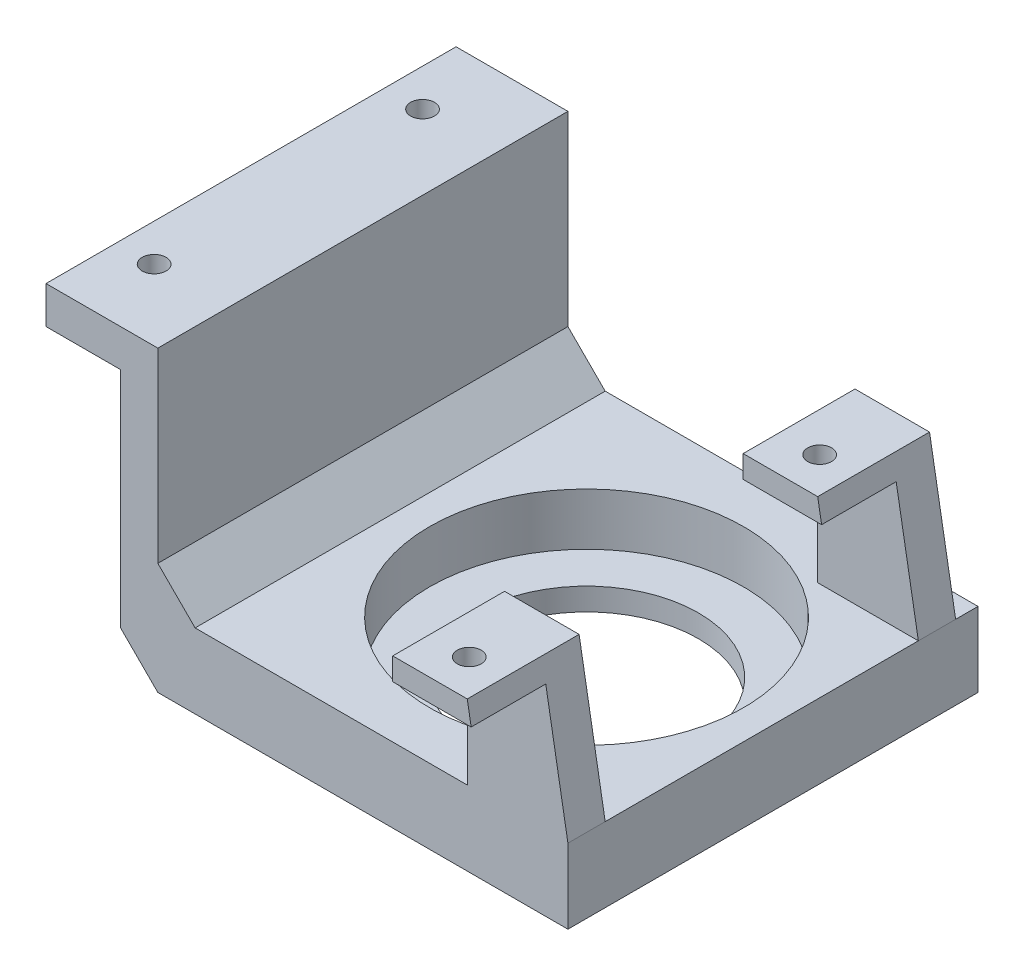
from build123d import *

# Parameters (mm, degrees)
SALIENTE_EXTRUIR2_DEPTH    = 55
CROQUIS6_R                 = 21.05
CORTAR_EXTRUIR1_DEPTH      = 7
CORTAR_EXTRUIR2_DEPTH      = 78.420927403
CORTAR_EXTRUIR2_DEPTH_BACK = 78.420927403
CROQUIS8_R                 = 15
CORTAR_EXTRUIR3_DEPTH      = 77.485292704
CORTAR_EXTRUIR3_DEPTH_BACK = 77.485292704
CROQUIS9_R                 = 1.6
CHAFL_N1_SIZE              = 5
CROQUIS11_W                = 10
CROQUIS11_H                = 5
SALIENTE_EXTRUIR3_DEPTH    = 20
CROQUIS13_W                = 10
CROQUIS13_H                = 5
SALIENTE_EXTRUIR5_DEPTH    = 20
SALIENTE_EXTRUIR7_DEPTH    = 5
SALIENTE_EXTRUIR8_DEPTH    = 5
SALIENTE_EXTRUIR9_DEPTH    = 10
SALIENTE_EXTRUIR10_DEPTH   = 10
CROQUIS15_R                = 1.6
CORTAR_EXTRUIR4_DEPTH      = 81.956778592


with BuildPart() as part:
    # Croquis4 → Saliente-Extruir2 (new body)
    with BuildSketch(Plane.XY):
        Polygon((-30, 5), (-30, 30), (-40, 30), (-40, 35), (-25, 35), (-25, 5), (30, 5), (30, -5), (-30, -5), align=None)
    extrude(amount=SALIENTE_EXTRUIR2_DEPTH)

    # Croquis6 → Cortar-Extruir1 (cut)
    with BuildSketch(Plane(origin=(0, 5, 0), x_dir=(1, 0, 0), z_dir=(0, 1, 0))):
        with Locations((5, -27.5)):
            Circle(CROQUIS6_R)
    extrude(amount=-CORTAR_EXTRUIR1_DEPTH, mode=Mode.SUBTRACT)

    # Croquis8 → Cortar-Extruir2 (cut, two sides: drawn at the far end of the back side and taken through both)
    with BuildSketch(Plane(origin=(0, -2, 0), x_dir=(1, 0, 0), z_dir=(0, 1, 0)).offset(-CORTAR_EXTRUIR2_DEPTH_BACK)):
        with Locations((5, -27.5)):
            Circle(CROQUIS8_R)
    extrude(amount=CORTAR_EXTRUIR2_DEPTH + CORTAR_EXTRUIR2_DEPTH_BACK, mode=Mode.SUBTRACT)

    # Croquis9 → Cortar-Extruir3 (cut, two sides: drawn at the far end of the back side and taken through both)
    with BuildSketch(Plane.XZ.offset(-30).offset(-CORTAR_EXTRUIR3_DEPTH_BACK)):
        with Locations((-35, 45.5)):
            Circle(CROQUIS9_R)
        with Locations((-35, 9.5)):
            Circle(CROQUIS9_R)
    extrude(amount=CORTAR_EXTRUIR3_DEPTH + CORTAR_EXTRUIR3_DEPTH_BACK, mode=Mode.SUBTRACT)

    # Chaflán1
    chafl_n1_edges = [part.edges().sort_by_distance(p)[0] for p in [
        (-25, 5, 27.5),
        (-30, -5, 27.5),
    ]]
    chamfer(chafl_n1_edges, length=CHAFL_N1_SIZE)

    # Croquis11 → Saliente-Extruir3 (add)
    with BuildSketch(Plane(origin=(0, 5, 0), x_dir=(1, 0, 0), z_dir=(0, 1, 0))):
        with Locations((21.5, -52.5)):
            Rectangle(CROQUIS11_W, CROQUIS11_H)
    extrude(amount=SALIENTE_EXTRUIR3_DEPTH)

    # Croquis13 → Saliente-Extruir5 (add)
    with BuildSketch(Plane(origin=(0, 5, 0), x_dir=(1, 0, 0), z_dir=(0, 1, 0))):
        with Locations((21.5, -5.5)):
            Rectangle(CROQUIS13_W, CROQUIS13_H)
    extrude(amount=SALIENTE_EXTRUIR5_DEPTH)

    # Croquis16 → Saliente-Extruir7 (add)
    with BuildSketch(Plane.XY.offset(55)):
        Polygon((30, 5), (26.5, 25), (26.5, 5), align=None)
    extrude(amount=-SALIENTE_EXTRUIR7_DEPTH)

    # Croquis17 → Saliente-Extruir8 (add)
    with BuildSketch(Plane.XY.offset(8)):
        Polygon((30, 5), (26.5, 25), (26.5, 5), align=None)
    extrude(amount=-SALIENTE_EXTRUIR8_DEPTH)

    # Croquis19 → Saliente-Extruir9 (add)
    with BuildSketch(Plane.XY.offset(55)):
        Polygon((16.5, 25), (16.5, 22), (27.025, 22), (26.5, 25), align=None)
    extrude(amount=SALIENTE_EXTRUIR9_DEPTH)

    # Croquis20 → Saliente-Extruir10 (add)
    with BuildSketch(Plane.XY.offset(8)):
        Polygon((16.5, 25), (16.5, 22), (27.025, 22), (26.5, 25), align=None)
    extrude(amount=SALIENTE_EXTRUIR10_DEPTH)

    # Croquis15 → Cortar-Extruir4 (cut, through all)
    with BuildSketch(Plane.XZ.offset(-22)):
        with Locations((21.7625, 60)):
            Circle(CROQUIS15_R)
        with Locations((21.7625, 13)):
            Circle(CROQUIS15_R)
    extrude(amount=-CORTAR_EXTRUIR4_DEPTH, mode=Mode.SUBTRACT)


solid = part.part
